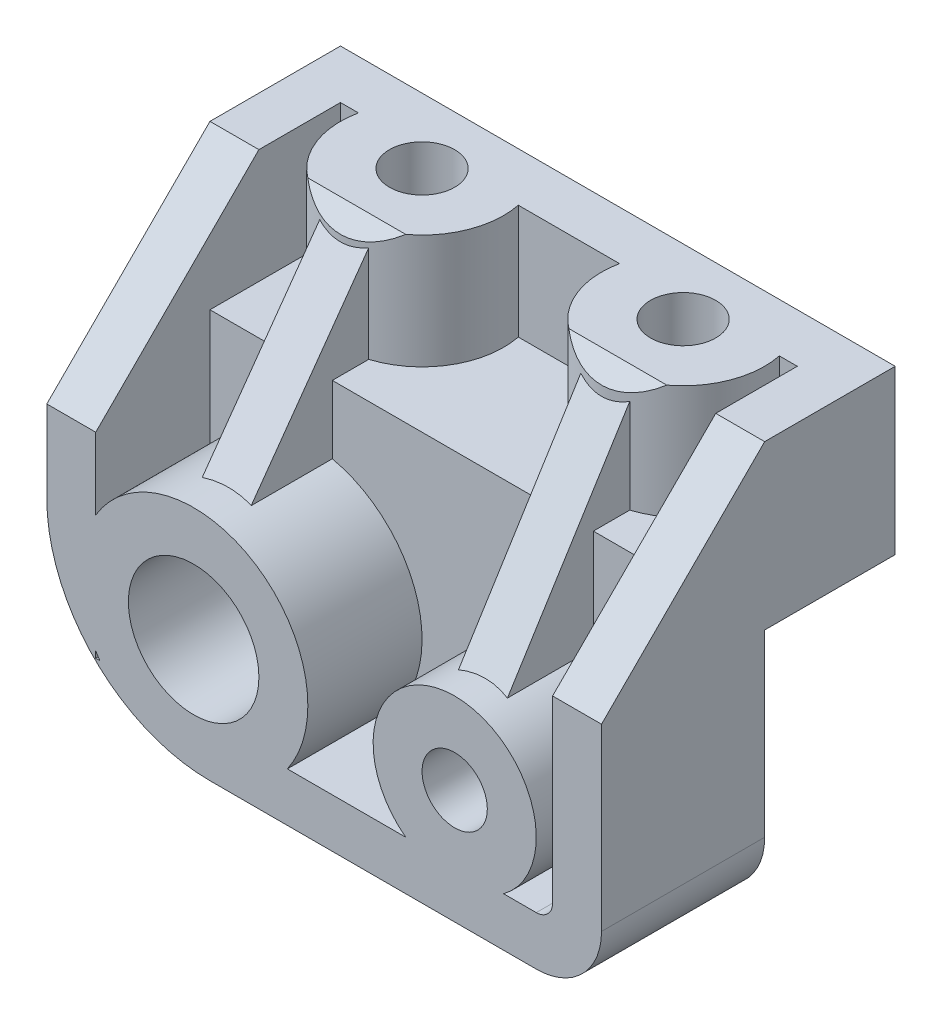
from build123d import *

# Parameters (mm, degrees)
ESQUISSE1_W        = 34
ESQUISSE1_H        = 15
ESQUISSE1_R        = 4
ESQUISSE1_R_2      = 2
BOSS_EXTRU_2_DEPTH = 10
ESQUISSE2_W        = 34
ESQUISSE2_H        = 18
ESQUISSE2_R        = 2
BOSS_EXTRU_3_DEPTH = 10
CHANFREIN1_SIZE    = 10
COQUE4_START       = 3
COQUE4_DEPTH       = 7
COQUE4_START_2     = 1
COQUE4_2_OUTLINE_W = 28
COQUE4_2_OUTLINE_H = 7
COQUE4_2_DEPTH     = 2
COQUE4_START_3     = 85.003902516
COQUE4_3_DEPTH     = 7
NERVURE3_REACH     = 97.863
ESQUISSE4_WALL_W   = 212.593996784
ESQUISSE4_WALL_H   = 3
CONG_1_R           = 10
CONG_2_R           = 1
CONG_3_R           = 4
NERVURE4_REACH     = 97.863
ESQUISSE6_WALL_W   = 210.930685054
ESQUISSE6_WALL_H   = 3


with BuildPart() as part:
    # Esquisse1 → Boss.-Extru.2 (new body)
    with BuildSketch(Plane.XY):
        with Locations((0, 74.503902516)):
            Rectangle(ESQUISSE1_W, ESQUISSE1_H)
        with Locations((-8, 74.003902516)):
            Circle(ESQUISSE1_R, mode=Mode.SUBTRACT)
        with Locations((8, 74.003902516)):
            Circle(ESQUISSE1_R_2, mode=Mode.SUBTRACT)
    extrude(amount=BOSS_EXTRU_2_DEPTH)

    # Esquisse2 → Boss.-Extru.3 (add)
    with BuildSketch(Plane(origin=(0, 82.003902516, 0), x_dir=(1, 0, 0), z_dir=(0, 1, 0))):
        with Locations((0, -1)):
            Rectangle(ESQUISSE2_W, ESQUISSE2_H)
        with Locations(Location((-8, 4, 0), (0, 0, 270))):
            Circle(ESQUISSE2_R, mode=Mode.SUBTRACT)
        with Locations(Location((8, 4, 0), (0, 0, 270))):
            Circle(ESQUISSE2_R, mode=Mode.SUBTRACT)
    extrude(amount=BOSS_EXTRU_3_DEPTH)

    # Chanfrein1
    chanfrein1_edges = [part.edges().sort_by_distance(p)[0] for p in [
        (0, 92.003902516, 10),
    ]]
    chamfer(chanfrein1_edges, length=CHANFREIN1_SIZE)

    # Coque4: read off the stored shape, not the designer's step
    # Coque4 outline → Coque4 (cut)
    with BuildSketch(Plane.XY.offset(COQUE4_START)):
        with BuildLine():
            Line((14, 70.003902516), (14, 92.003902516))
            Line((14, 92.003902516), (-14, 92.003902516))
            Line((-14, 92.003902516), (-14, 77.609453792))
            ThreePointArc((-14, 77.609453792), (-4.195080209, 79.87949486), (-2.255437353, 70.003902516))
            Line((-2.255437353, 70.003902516), (5, 70.003902516))
            ThreePointArc((5, 70.003902516), (8, 79.003902516), (11, 70.003902516))
            Line((11, 70.003902516), (14, 70.003902516))
        make_face()
        with BuildLine():
            Line((-14, 70.003902516), (-13.744562647, 70.003902516))
            ThreePointArc((-13.744562647, 70.003902516), (-13.875592344, 70.198982726), (-14, 70.398351241))
            Line((-14, 70.398351241), (-14, 70.003902516))
        make_face()
    extrude(amount=COQUE4_DEPTH, mode=Mode.SUBTRACT)

    # Coque4 2 outline → Coque4 2 (cut)
    with BuildSketch(Plane.XY.offset(COQUE4_START_2)):
        with Locations((0, 88.503902516)):
            Rectangle(COQUE4_2_OUTLINE_W, COQUE4_2_OUTLINE_H)
    extrude(amount=COQUE4_2_DEPTH, mode=Mode.SUBTRACT)

    # Coque4 3 outline → Coque4 3 (cut)
    with BuildSketch(Plane(origin=(0, 0, 0), x_dir=(1, 0, 0), z_dir=(0, 1, 0)).offset(COQUE4_START_3)):
        with BuildLine():
            Line((14, 5), (12.898979486, 5))
            ThreePointArc((12.898979486, 5), (11.872983347, 0.83772234), (8, -1))
            Line((8, -1), (14, -1))
            Line((14, -1), (14, 5))
        make_face()
        with BuildLine():
            Line((-14, -1), (-8, -1))
            ThreePointArc((-8, -1), (-11.872983346, 0.83772234), (-12.898979485, 5))
            Line((-12.898979485, 5), (-14, 5))
            Line((-14, 5), (-14, -1))
        make_face()
        with BuildLine():
            Line((-8, -1), (8, -1))
            ThreePointArc((8, -1), (4.127016654, 0.83772234), (3.101020515, 5))
            Line((3.101020515, 5), (-3.101020514, 5))
            ThreePointArc((-3.101020514, 5), (-4.127016653, 0.83772234), (-8, -1))
        make_face()
    extrude(amount=COQUE4_3_DEPTH, mode=Mode.SUBTRACT)

    # Esquisse4 wall → Nervure3 (add, up to next)
    with BuildSketch(Plane(origin=(8, 84.003902516, 5), x_dir=(0, 0.847998304005, -0.529998940003), z_dir=(0, -0.529998940003, -0.847998304005)), mode=Mode.PRIVATE) as nervure3_sk1:
        Rectangle(ESQUISSE4_WALL_W, ESQUISSE4_WALL_H)
    nervure3_tool1 = extrude(nervure3_sk1.sketch, amount=NERVURE3_REACH, mode=Mode.PRIVATE) - part.part
    add(nervure3_tool1.solids().sort_by_distance((8, 84.003902516, 5))[0])

    # Congé1
    cong_1_edges = [part.edges().sort_by_distance(p)[0] for p in [
        (-17, 67.003902516, 5),
    ]]
    fillet(cong_1_edges, radius=CONG_1_R)

    # Congé2
    cong_2_edges = [part.edges().sort_by_distance(p)[0] for p in [
        (14, 70.003902516, 6.5),
    ]]
    fillet(cong_2_edges, radius=CONG_2_R)

    # Congé3
    cong_3_edges = [part.edges().sort_by_distance(p)[0] for p in [
        (17, 67.003902516, 5),
    ]]
    fillet(cong_3_edges, radius=CONG_3_R)

    # Esquisse6 wall → Nervure4 (add, up to next)
    with BuildSketch(Plane(origin=(-8, 85.003902516, 5), x_dir=(0, -0.813733471207, 0.581238193719), z_dir=(0, 0.581238193719, 0.813733471207)), mode=Mode.PRIVATE) as nervure4_sk1:
        Rectangle(ESQUISSE6_WALL_W, ESQUISSE6_WALL_H)
    nervure4_tool1 = extrude(nervure4_sk1.sketch, amount=-NERVURE4_REACH, mode=Mode.PRIVATE) - part.part
    add(nervure4_tool1.solids().sort_by_distance((-8, 85.003902516, 5))[0])


solid = part.part
